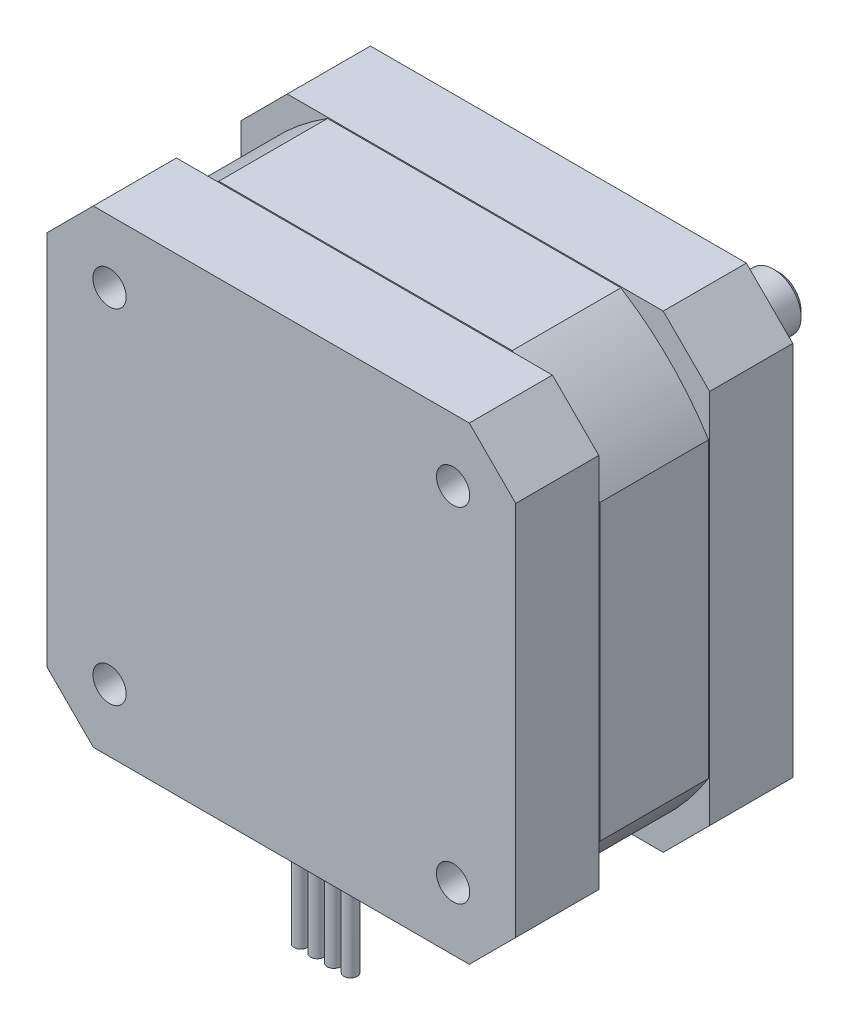
from build123d import *

# Parameters (mm, degrees)
ESQUISSE1_R             = 1.5
EXTRUSION1_DEPTH        = 25
ESQUISSE10_W            = 8
ESQUISSE10_H            = 4
ESQUISSE10_W_2          = 7
ESQUISSE10_H_2          = 3
BOSS_EXTRU_2_DEPTH      = 0.3
ESQUISSE2_R             = 11
EXTRUSION2_DEPTH        = 2
ESQUISSE3_R             = 2.5
EXTRUSION3_DEPTH        = 17.9
ENL_V_START             = -1.6
ESQUISSE4_R             = 4
ESQUISSE4_R_2           = 2.5
ENL_V_MAT_EXTRU_1_DEPTH = 1.6
CHANFREIN1_SIZE         = 0.5
ESQUISSE6_R             = 34.95
ESQUISSE6_R_2           = 24.95
ENL_V_MAT_EXTRU_3_DEPTH = 5
ESQUISSE7_R             = 25.05
ESQUISSE7_R_2           = 19.05
ENL_V_MAT_EXTRU_4_DEPTH = 0.1
SYM_TRIE1_START         = 12.5
SYM_TRIE1_DEPTH         = 5
SYM_TRIE1_START_2       = 17.4
SYM_TRIE1_2_OUTLINE_R   = 19.05
SYM_TRIE1_2_DEPTH       = 0.1
ESQUISSE10_3_R          = 0.6
BOSS_EXTRU_3_DEPTH      = 10


# Read off the part's stored shape, not the designer's step: Symétrie1
with BuildPart() as part:
    # Esquisse1 → Extrusion1 (new body)
    with BuildSketch(Plane.XY):
        Polygon((-16.963055506, 21.15), (16.963055506, 21.15), (21.15, 16.963055506), (21.15, -16.963055506), (16.963055506, -21.15), (-16.963055506, -21.15), (-21.15, -16.963055506), (-21.15, 16.963055506), align=None)
        with Locations((-15.5, 15.5)):
            Circle(ESQUISSE1_R, mode=Mode.SUBTRACT)
        with Locations((15.5, -15.5)):
            Circle(ESQUISSE1_R, mode=Mode.SUBTRACT)
        with Locations(Location((-15.5, -15.5, 0), (0, 0, 180))):
            Circle(ESQUISSE1_R, mode=Mode.SUBTRACT)
        with Locations(Location((15.5, 15.5, 0), (0, 0, 180))):
            Circle(ESQUISSE1_R, mode=Mode.SUBTRACT)
    extrude(amount=EXTRUSION1_DEPTH)

    # Esquisse10 → Boss.-Extru.2 (add)
    with BuildSketch(Plane.XZ.offset(21.15)):
        with Locations((0, 21)):
            Rectangle(ESQUISSE10_W, ESQUISSE10_H)
        with Locations((0, 21)):
            Rectangle(ESQUISSE10_W_2, ESQUISSE10_H_2, mode=Mode.SUBTRACT)
    extrude(amount=BOSS_EXTRU_2_DEPTH)

    # Esquisse2 → Extrusion2 (add)
    with BuildSketch(Plane(origin=(0, 0, 0), x_dir=(-1, 0, 0), z_dir=(0, 0, -1))):
        with Locations(Location((0, 0, 0), (0, 0, 180))):
            Circle(ESQUISSE2_R)
    extrude(amount=EXTRUSION2_DEPTH)

    # Esquisse3 → Extrusion3 (add)
    with BuildSketch(Plane(origin=(0, 0, -2), x_dir=(-1, 0, 0), z_dir=(0, 0, -1))):
        with Locations(Location((0, 0, 0), (0, 0, 180))):
            Circle(ESQUISSE3_R)
    extrude(amount=EXTRUSION3_DEPTH)

    # Esquisse4 → Enlèv. mat.-Extru.1 (cut)
    with BuildSketch(Plane(origin=(0, 0, -2), x_dir=(-1, 0, 0), z_dir=(0, 0, -1)).offset(ENL_V_START)):
        Circle(ESQUISSE4_R)
        with Locations(Location((0, 0, 0), (0, 0, 180))):
            Circle(ESQUISSE4_R_2, mode=Mode.SUBTRACT)
    extrude(amount=ENL_V_MAT_EXTRU_1_DEPTH, mode=Mode.SUBTRACT)

    # Chanfrein1
    chanfrein1_edges = [part.edges().sort_by_distance(p)[0] for p in [
        (-2.5, 0, -19.9),
    ]]
    chamfer(chanfrein1_edges, length=CHANFREIN1_SIZE)

    # Esquisse6 → Enlèv. mat.-Extru.3 (cut)
    with BuildSketch(Plane(origin=(0, 0, 7.5), x_dir=(-1, 0, 0), z_dir=(0, 0, -1))):
        Circle(ESQUISSE6_R)
        Circle(ESQUISSE6_R_2, mode=Mode.SUBTRACT)
    extrude(amount=-ENL_V_MAT_EXTRU_3_DEPTH, mode=Mode.SUBTRACT)

    # Esquisse7 → Enlèv. mat.-Extru.4 (cut)
    with BuildSketch(Plane(origin=(0, 0, 7.5), x_dir=(-1, 0, 0), z_dir=(0, 0, -1))):
        Circle(ESQUISSE7_R)
        Circle(ESQUISSE7_R_2, mode=Mode.SUBTRACT)
    extrude(amount=-ENL_V_MAT_EXTRU_4_DEPTH, mode=Mode.SUBTRACT)

    # Symétrie1 outline → Symétrie1 (cut)
    with BuildSketch(Plane.XY.offset(SYM_TRIE1_START)):
        with BuildLine():
            Line((21.15, -16.963055506), (21.15, -13.235558167))
            ThreePointArc((21.15, -13.235558167), (17.642314191, -17.642314191), (13.235558167, -21.15))
            Line((13.235558167, -21.15), (16.963055506, -21.15))
            Line((16.963055506, -21.15), (21.15, -16.963055506))
        make_face()
        with BuildLine():
            ThreePointArc((13.235558167, 21.15), (17.642314191, 17.642314191), (21.15, 13.235558167))
            Line((21.15, 13.235558167), (21.15, 16.963055506))
            Line((21.15, 16.963055506), (16.963055506, 21.15))
            Line((16.963055506, 21.15), (13.235558167, 21.15))
        make_face()
        with BuildLine():
            Line((-16.963055506, -21.15), (-13.235558167, -21.15))
            ThreePointArc((-13.235558167, -21.15), (-17.642314191, -17.642314191), (-21.15, -13.235558167))
            Line((-21.15, -13.235558167), (-21.15, -16.963055506))
            Line((-21.15, -16.963055506), (-16.963055506, -21.15))
        make_face()
        with BuildLine():
            ThreePointArc((-21.15, 13.235558167), (-17.642314191, 17.642314191), (-13.235558167, 21.15))
            Line((-13.235558167, 21.15), (-16.963055506, 21.15))
            Line((-16.963055506, 21.15), (-21.15, 16.963055506))
            Line((-21.15, 16.963055506), (-21.15, 13.235558167))
        make_face()
    extrude(amount=SYM_TRIE1_DEPTH, mode=Mode.SUBTRACT)

    # Sym_trie1 2 outline → Sym_trie1 2 (cut)
    with BuildSketch(Plane.XY.offset(SYM_TRIE1_START_2)):
        with BuildLine():
            ThreePointArc((13.235558167, -21.15), (17.642314191, -17.642314191), (21.15, -13.235558167))
            Line((21.15, -13.235558167), (21.15, 13.235558167))
            ThreePointArc((21.15, 13.235558167), (17.642314191, 17.642314191), (13.235558167, 21.15))
            Line((13.235558167, 21.15), (-13.235558167, 21.15))
            ThreePointArc((-13.235558167, 21.15), (-17.642314191, 17.642314191), (-21.15, 13.235558167))
            Line((-21.15, 13.235558167), (-21.15, -13.235558167))
            ThreePointArc((-21.15, -13.235558167), (-17.642314191, -17.642314191), (-13.235558167, -21.15))
            Line((-13.235558167, -21.15), (13.235558167, -21.15))
        make_face()
        Circle(SYM_TRIE1_2_OUTLINE_R, mode=Mode.SUBTRACT)
    extrude(amount=SYM_TRIE1_2_DEPTH, mode=Mode.SUBTRACT)

    # Esquisse10<3> → Boss.-Extru.3 (add)
    with BuildSketch(Plane.XZ.offset(21.15)):
        with Locations(Location((2.25, 21, 0), (0, 0, 90))):
            Circle(ESQUISSE10_3_R)
        with Locations(Location((0.75, 21, 0), (0, 0, 90))):
            Circle(ESQUISSE10_3_R)
        with Locations(Location((-0.75, 21, 0), (0, 0, 90))):
            Circle(ESQUISSE10_3_R)
        with Locations(Location((-2.25, 21, 0), (0, 0, 90))):
            Circle(ESQUISSE10_3_R)
    extrude(amount=BOSS_EXTRU_3_DEPTH)


solid = part.part
